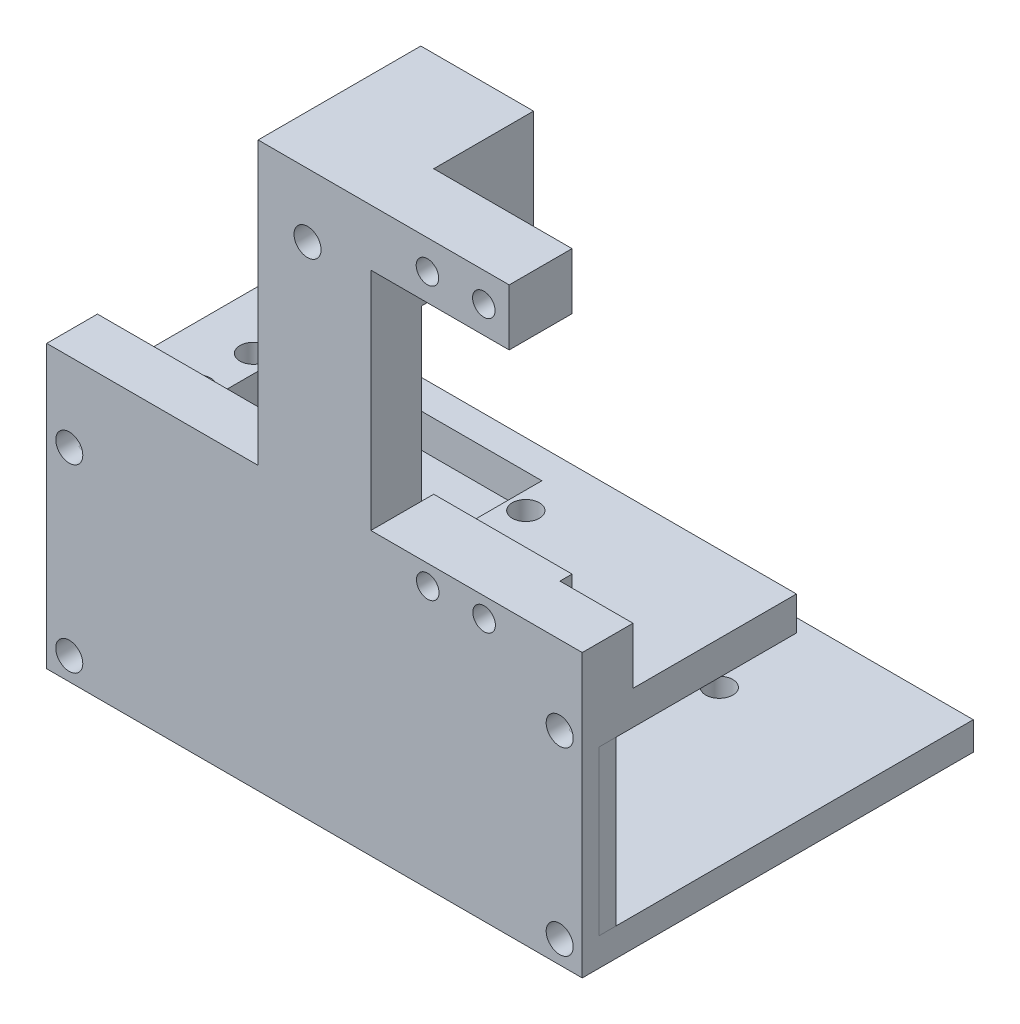
from build123d import *

# Parameters (mm, degrees)
SKETCH1_W            = 75
SKETCH1_H            = 45
BOSS_EXTRUDE1_DEPTH  = 5
SKETCH3_W            = 75
SKETCH3_H            = 4
BOSS_EXTRUDE3_DEPTH  = 24
SKETCH4_W            = 75
SKETCH4_H            = 5
BOSS_EXTRUDE4_DEPTH  = 24
SKETCH9_R            = 2.4
CUT_EXTRUDE3_DEPTH   = 70.296464556
CHAMFER1_SIZE        = 5
CHAMFER2_SIZE        = 5
BOSS_EXTRUDE6_START  = 63
SKETCH13_W           = 75
SKETCH13_H           = 36.366792108
BOSS_EXTRUDE6_DEPTH  = 10
SKETCH14_R           = 2.4
CUT_EXTRUDE5_DEPTH   = 93.655275079
SKETCH15_W           = 42
SKETCH15_H           = 22
CUT_EXTRUDE6_DEPTH   = 93.655275079
SKETCH16_W           = 75
SKETCH16_H           = 5
BOSS_EXTRUDE7_DEPTH  = 39
SKETCH17_W           = 69
SKETCH17_H           = 24
CUT_EXTRUDE7_DEPTH   = 111.385687478
SKETCH18_W           = 75
SKETCH18_H           = 3
BOSS_EXTRUDE8_DEPTH  = 34
CUT_EXTRUDE8_DEPTH   = 75.040529442
SKETCH21_R           = 20
CUT_EXTRUDE9_DEPTH   = 9
SKETCH23_W           = 69.366792108
SKETCH23_H           = 5
BOSS_EXTRUDE9_DEPTH  = 10
SKETCH24_W           = 36.366792108
SKETCH24_H           = 10
BOSS_EXTRUDE10_DEPTH = 10
SKETCH25_R           = 2.4
CUT_EXTRUDE10_DEPTH  = 10
SKETCH26_R           = 20
CUT_EXTRUDE11_DEPTH  = 10
SKETCH27_W           = 69.366792108
SKETCH27_H           = 5
BOSS_EXTRUDE11_DEPTH = 10
SKETCH28_W           = 36.366792108
SKETCH28_H           = 4
CUT_EXTRUDE12_DEPTH  = 125.839897469
SKETCH29_W           = 95
SKETCH29_H           = 40
BOSS_EXTRUDE13_DEPTH = 3
SKETCH30_W           = 10
SKETCH30_H           = 6
BOSS_EXTRUDE14_DEPTH = 35
SKETCH31_W           = 85
SKETCH31_H           = 6
BOSS_EXTRUDE15_DEPTH = 1.632
SKETCH34_R           = 2.4
CUT_EXTRUDE13_DEPTH  = 6
SKETCH35_W           = 95
SKETCH35_H           = 29
BOSS_EXTRUDE18_DEPTH = 3
SKETCH37_R           = 20
CUT_EXTRUDE14_DEPTH  = 34
SKETCH38_R           = 2.4
CUT_EXTRUDE15_DEPTH  = 6
SKETCH39_W           = 95
SKETCH39_H           = 9
BOSS_EXTRUDE19_DEPTH = 10
SKETCH54_W           = 10
SKETCH54_H           = 9
BOSS_EXTRUDE29_DEPTH = 50
SKETCH55_W           = 20
SKETCH55_H           = 20
BOSS_EXTRUDE30_DEPTH = 19.86
SKETCH56_R           = 2.4
CUT_EXTRUDE18_DEPTH  = 142.569065148
SKETCH57_W           = 11.15
SKETCH57_H           = 10
BOSS_EXTRUDE31_DEPTH = 24.54
SKETCH58_W           = 24.54
SKETCH58_H           = 10
BOSS_EXTRUDE32_DEPTH = 2.15
SKETCH59_R           = 2
CUT_EXTRUDE19_DEPTH  = 153.357316357


with BuildPart() as part:
    # Sketch1 → Boss-Extrude1 (new body)
    with BuildSketch(Plane(origin=(0, 0, 0), x_dir=(1, 0, 0), z_dir=(0, 1, 0))):
        with Locations((-7.5, -2.5)):
            Rectangle(SKETCH1_W, SKETCH1_H)
    extrude(amount=BOSS_EXTRUDE1_DEPTH)

    # Sketch3 → Boss-Extrude3 (add)
    with BuildSketch(Plane(origin=(0, 5, 0), x_dir=(1, 0, 0), z_dir=(0, 1, 0))):
        with Locations((-7.5, 18)):
            Rectangle(SKETCH3_W, SKETCH3_H)
    extrude(amount=BOSS_EXTRUDE3_DEPTH)

    # Sketch4 → Boss-Extrude4 (add)
    with BuildSketch(Plane(origin=(0, 0, -20), x_dir=(-1, 0, 0), z_dir=(0, 0, -1))):
        with Locations((7.5, 26.5)):
            Rectangle(SKETCH4_W, SKETCH4_H)
    extrude(amount=BOSS_EXTRUDE4_DEPTH)

    # Sketch9 → Cut-Extrude3 (cut, through all)
    with BuildSketch(Plane(origin=(0, 29, 0), x_dir=(1, 0, 0), z_dir=(0, 1, 0))):
        with Locations(Location((-27.5, 26.45, 0), (0, 0, 270))):
            Circle(SKETCH9_R)
        with Locations(Location((12.5, 26.45, 0), (0, 0, 270))):
            Circle(SKETCH9_R)
    extrude(amount=-CUT_EXTRUDE3_DEPTH, mode=Mode.SUBTRACT)

    # Chamfer1
    chamfer1_edges = [part.edges().sort_by_distance(p)[0] for p in [
        (-7.5, 5, -16),
    ]]
    chamfer(chamfer1_edges, length=CHAMFER1_SIZE)

    # Chamfer2
    # the kernel refuses this chamfer: 5 mm, written as the material it adds along each edge
    with BuildSketch(Plane(origin=(-45, 24, -20), x_dir=(0, -0.9996219169112968, 0.027495876610586317), z_dir=(1, 0, 0))) as chamfer2_piece_1_section:
        Polygon((CHAMFER2_SIZE * 0.999621916911, CHAMFER2_SIZE * 0.0274958766106), (-CHAMFER2_SIZE * 0.0274958766106, CHAMFER2_SIZE * 0.999621916911), (0, 0), align=None)
    chamfer2_piece_1 = extrude(amount=75, mode=Mode.PRIVATE)
    chamfer2_piece_1 = chamfer2_piece_1 - Plane(origin=(12.5, 22.346344927, -26.45), x_dir=(0, 0, 1), z_dir=(0, 1, 0)) * Cylinder(2.4, 170, mode=Mode.PRIVATE)
    chamfer2_piece_1 = chamfer2_piece_1 - Plane(origin=(-27.5, 22.346344927, -26.45), x_dir=(0, 0, 1), z_dir=(0, 1, 0)) * Cylinder(2.4, 170, mode=Mode.PRIVATE)
    add(chamfer2_piece_1)

    # Sketch16 → Boss-Extrude7 (add)
    with BuildSketch(Plane.XY.offset(-16)):
        with Locations((-7.5, 26.5)):
            Rectangle(SKETCH16_W, SKETCH16_H)
    extrude(amount=BOSS_EXTRUDE7_DEPTH)

    # Sketch17 → Cut-Extrude7 (cut, through all)
    with BuildSketch(Plane.ZY.offset(45)):
        with Locations((-9.5, 12)):
            Rectangle(SKETCH17_W, SKETCH17_H)
    extrude(amount=-CUT_EXTRUDE7_DEPTH, mode=Mode.SUBTRACT)

    # Sketch20 → Cut-Extrude8 (cut, through all)
    with BuildSketch(Plane(origin=(0, 29, 0), x_dir=(1, 0, 0), z_dir=(0, 1, 0))):
        with BuildLine():
            Line((-47.123796028, 5.445327082), (-47.123796028, -15.626239287))
            Line((-47.123796028, -15.626239287), (7.609194621, -15.626239287))
            Line((7.609194621, -15.626239287), (7.609194621, 9.373760713))
            Line((7.609194621, 9.373760713), (-17.647352776, 9.373760713))
            ThreePointArc((-17.647352776, 9.373760713), (-34.105380145, 20.313861791), (-47.123796028, 5.445327082))
        make_face()
    extrude(amount=-CUT_EXTRUDE8_DEPTH, mode=Mode.SUBTRACT)


with BuildPart() as body_2:
    # Sketch13 → Boss-Extrude6 (new body)
    with BuildSketch(Plane(origin=(0, 5, 0), x_dir=(1, 0, 0), z_dir=(0, 1, 0)).offset(BOSS_EXTRUDE6_START)):
        with Locations((-7.5, -7.183396054)):
            Rectangle(SKETCH13_W, SKETCH13_H)
    extrude(amount=-BOSS_EXTRUDE6_DEPTH)

    # Sketch14 → Cut-Extrude5 (cut, through all)
    with BuildSketch(Plane(origin=(0, 68, 0), x_dir=(1, 0, 0), z_dir=(0, 1, 0))):
        with Locations((-45.123796028, -8.554672918)):
            Circle(SKETCH14_R)
        with Locations((-45.123796028, 1.445327082)):
            Circle(SKETCH14_R)
        with Locations(Location((3.176203972, 1.445327082, 0), (0, 0, 270))):
            Circle(SKETCH14_R)
        with Locations(Location((3.176203972, -8.554672918, 0), (0, 0, 270))):
            Circle(SKETCH14_R)
    extrude(amount=-CUT_EXTRUDE5_DEPTH, mode=Mode.SUBTRACT)

    # Sketch15 → Cut-Extrude6 (cut, through all)
    with BuildSketch(Plane(origin=(0, 68, 0), x_dir=(1, 0, 0), z_dir=(0, 1, 0))):
        with Locations((-20.973796028, -3.554672918)):
            Rectangle(SKETCH15_W, SKETCH15_H)
    extrude(amount=-CUT_EXTRUDE6_DEPTH, mode=Mode.SUBTRACT)

    # Sketch18 → Boss-Extrude8 (add)
    with BuildSketch(Plane.XZ.offset(-58)):
        with Locations((-7.5, 23.866792108)):
            Rectangle(SKETCH18_W, SKETCH18_H)
    extrude(amount=BOSS_EXTRUDE8_DEPTH)


with BuildPart() as cut_extrude9_tool:
    # Sketch21 → Cut-Extrude9 (new body)
    with BuildSketch(Plane(origin=(0, 24, 0), x_dir=(-1, 0, 0), z_dir=(0, -1, 0))):
        with Locations((30.973796028, -3.554672918)):
            Circle(SKETCH21_R)
    extrude(amount=-CUT_EXTRUDE9_DEPTH)


with BuildPart() as part_1:
    add(part.part)

    # Cut-Extrude9: cut by cut_extrude9_tool
    add(cut_extrude9_tool.part, mode=Mode.SUBTRACT)



with BuildPart() as body_2_1:
    add(body_2.part)

    # Cut-Extrude9: cut by cut_extrude9_tool
    add(cut_extrude9_tool.part, mode=Mode.SUBTRACT)


with BuildPart() as part_2:
    add(part_1.part)

    add(body_2_1.part)  # Boss-Extrude9 merges body 2
    # Sketch23 → Boss-Extrude9 (add)
    with BuildSketch(Plane.ZY.offset(45)):
        with Locations((-9.316603946, 26.5)):
            Rectangle(SKETCH23_W, SKETCH23_H)
    extrude(amount=BOSS_EXTRUDE9_DEPTH)

    # Sketch24 → Boss-Extrude10 (add)
    with BuildSketch(Plane.ZY.offset(45)):
        with Locations((7.183396054, 63)):
            Rectangle(SKETCH24_W, SKETCH24_H)
    extrude(amount=BOSS_EXTRUDE10_DEPTH)

    # Sketch25 → Cut-Extrude10 (cut)
    with BuildSketch(Plane(origin=(0, 68, 0), x_dir=(1, 0, 0), z_dir=(0, 1, 0))):
        with Locations(Location((3.176203972, 1.445327082, 0), (0, 0, 270))):
            Circle(SKETCH25_R)
        with Locations(Location((3.176203972, -8.554672918, 0), (0, 0, 270))):
            Circle(SKETCH25_R)
        with Locations(Location((-45.123796028, 1.445327082, 0), (0, 0, 270))):
            Circle(SKETCH25_R)
        with Locations(Location((-45.123796028, -8.554672918, 0), (0, 0, 270))):
            Circle(SKETCH25_R)
    extrude(amount=-CUT_EXTRUDE10_DEPTH, mode=Mode.SUBTRACT)

    # Sketch26 → Cut-Extrude11 (cut)
    with BuildSketch(Plane.XZ.offset(-24)):
        with Locations((-30.973796028, 3.554672918)):
            Circle(SKETCH26_R)
    extrude(amount=-CUT_EXTRUDE11_DEPTH, mode=Mode.SUBTRACT)

    # Sketch27 → Boss-Extrude11 (add)
    with BuildSketch(Plane(origin=(30, 0, 0), x_dir=(0, 0, -1), z_dir=(1, 0, 0))):
        with Locations((9.316603946, 26.5)):
            Rectangle(SKETCH27_W, SKETCH27_H)
    extrude(amount=BOSS_EXTRUDE11_DEPTH)

    # Sketch28 → Cut-Extrude12 (cut, through all)
    with BuildSketch(Plane.ZY.offset(55)):
        with Locations((7.183396054, 66)):
            Rectangle(SKETCH28_W, SKETCH28_H)
    extrude(amount=-CUT_EXTRUDE12_DEPTH, mode=Mode.SUBTRACT)

    # Sketch29 → Boss-Extrude13 (add)
    with BuildSketch(Plane.XY.offset(25.366792108)):
        with Locations((-7.5, 44)):
            Rectangle(SKETCH29_W, SKETCH29_H)
    extrude(amount=-BOSS_EXTRUDE13_DEPTH)

    # Sketch30 → Boss-Extrude14 (add)
    with BuildSketch(Plane(origin=(0, 0, 22.366792108), x_dir=(-1, 0, 0), z_dir=(0, 0, -1))):
        with Locations((-35, 61)):
            Rectangle(SKETCH30_W, SKETCH30_H)
    extrude(amount=BOSS_EXTRUDE14_DEPTH)

    # Sketch31 → Boss-Extrude15 (add)
    with BuildSketch(Plane(origin=(0, 0, -11), x_dir=(-1, 0, 0), z_dir=(0, 0, -1))):
        with Locations((12.5, 61)):
            Rectangle(SKETCH31_W, SKETCH31_H)
    extrude(amount=BOSS_EXTRUDE15_DEPTH)

    # Sketch34 → Cut-Extrude13 (cut)
    with BuildSketch(Plane.XY.offset(25.366792108)):
        with Locations((-51, 60)):
            Circle(SKETCH34_R)
        with Locations((36, 60)):
            Circle(SKETCH34_R)
        with Locations((-51, 28)):
            Circle(SKETCH34_R)
        with Locations((36, 28)):
            Circle(SKETCH34_R)
    extrude(amount=-CUT_EXTRUDE13_DEPTH, mode=Mode.SUBTRACT)


with BuildPart() as body_2_2:
    # Sketch35 → Boss-Extrude18 (new body)
    with BuildSketch(Plane(origin=(0, 0, 22.366792108), x_dir=(-1, 0, 0), z_dir=(0, 0, -1))):
        with Locations((7.5, 43.5)):
            Rectangle(SKETCH35_W, SKETCH35_H)
    extrude(amount=BOSS_EXTRUDE18_DEPTH)


with BuildPart() as cut_extrude14_tool:
    # Sketch37 → Cut-Extrude14 (new body)
    with BuildSketch(Plane.XZ.offset(-24)):
        with Locations((-30.973796028, 3.554672918)):
            Circle(SKETCH37_R)
    extrude(amount=-CUT_EXTRUDE14_DEPTH)


with BuildPart() as part_3:
    add(part_2.part)

    # Cut-Extrude14: cut by cut_extrude14_tool
    add(cut_extrude14_tool.part, mode=Mode.SUBTRACT)

    # Sketch39 → Boss-Extrude19 (add)
    with BuildSketch(Plane(origin=(0, 64, 0), x_dir=(1, 0, 0), z_dir=(0, 1, 0))):
        with Locations((-7.5, -20.866792108)):
            Rectangle(SKETCH39_W, SKETCH39_H)
    extrude(amount=BOSS_EXTRUDE19_DEPTH)

    # Sketch54 → Boss-Extrude29 (add)
    with BuildSketch(Plane(origin=(0, 74, 0), x_dir=(1, 0, 0), z_dir=(0, 1, 0))):
        with Locations((-12.5, -20.866792108)):
            Rectangle(SKETCH54_W, SKETCH54_H)
        with Locations((-2.5, -20.866792108)):
            Rectangle(SKETCH54_W, SKETCH54_H)
    extrude(amount=BOSS_EXTRUDE29_DEPTH)

    # Sketch55 → Boss-Extrude30 (add)
    with BuildSketch(Plane(origin=(0, 0, 16.366792108), x_dir=(-1, 0, 0), z_dir=(0, 0, -1))):
        with Locations((7.5, 114)):
            Rectangle(SKETCH55_W, SKETCH55_H)
    extrude(amount=BOSS_EXTRUDE30_DEPTH)

    # Sketch56 → Cut-Extrude18 (cut, through all)
    with BuildSketch(Plane(origin=(0, 0, -3.493207892), x_dir=(-1, 0, 0), z_dir=(0, 0, -1))):
        with Locations((8.732204083, 112.708699922)):
            Circle(SKETCH56_R)
    extrude(amount=-CUT_EXTRUDE18_DEPTH, mode=Mode.SUBTRACT)

    # Sketch57 → Boss-Extrude31 (add)
    with BuildSketch(Plane(origin=(2.5, 0, 0), x_dir=(0, 0, -1), z_dir=(1, 0, 0))):
        with Locations((-19.791792108, 119)):
            Rectangle(SKETCH57_W, SKETCH57_H)
    extrude(amount=BOSS_EXTRUDE31_DEPTH)

    # Sketch58 → Boss-Extrude32 (add)
    with BuildSketch(Plane(origin=(0, 0, 16.366792108), x_dir=(-1, 0, 0), z_dir=(0, 0, -1))):
        with Locations((-14.77, 69)):
            Rectangle(SKETCH58_W, SKETCH58_H)
    extrude(amount=BOSS_EXTRUDE32_DEPTH)

    # Sketch59 → Cut-Extrude19 (cut, through all)
    with BuildSketch(Plane.XY.offset(25.366792108)):
        with Locations((12.539451267, 118.777854509)):
            Circle(SKETCH59_R)
        with Locations((22.539444861, 118.78917354)):
            Circle(SKETCH59_R)
        with Locations((12.594122185, 70.47788545)):
            Circle(SKETCH59_R)
        with Locations((22.594115779, 70.489204481)):
            Circle(SKETCH59_R)
    extrude(amount=-CUT_EXTRUDE19_DEPTH, mode=Mode.SUBTRACT)


with BuildPart() as body_2_2_1:
    add(body_2_2.part)

    # Cut-Extrude14: cut by cut_extrude14_tool
    add(cut_extrude14_tool.part, mode=Mode.SUBTRACT)

    # Sketch38 → Cut-Extrude15 (cut)
    with BuildSketch(Plane.XY.offset(25.366792108)):
        with Locations((36, 28)):
            Circle(SKETCH38_R)
        with Locations((-51, 28)):
            Circle(SKETCH38_R)
        with Locations((36, 60)):
            Circle(SKETCH38_R)
        with Locations((-51, 60)):
            Circle(SKETCH38_R)
    extrude(amount=-CUT_EXTRUDE15_DEPTH, mode=Mode.SUBTRACT)


solid = Compound([part_3.part, body_2_2_1.part])
